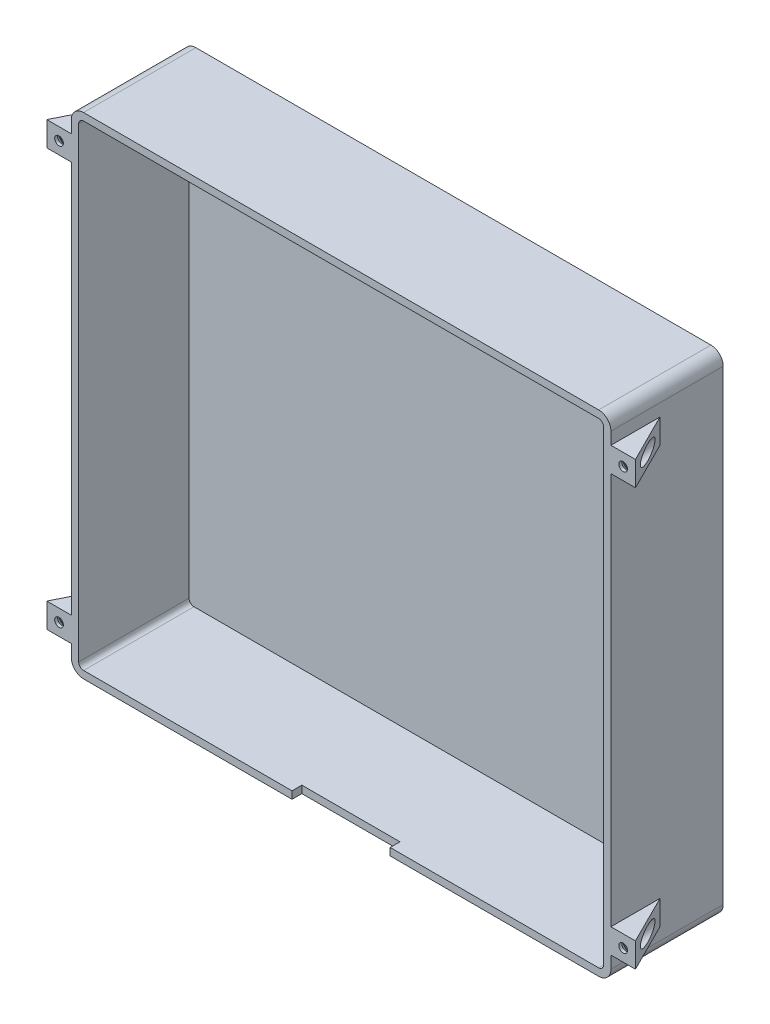
from build123d import *

# Parameters (mm, degrees)
SKETCH2_W               = 279.4
SKETCH2_H               = 254
BOSS_EXTRUDE1_DEPTH     = 1
FILLET2_R               = 6.35
BOSS_EXTRUDE3_START     = 57.15
BOSS_EXTRUDE3_DEPTH     = 57.15
SKETCH7_W               = 50.8
SKETCH7_H               = 5.08
CUT_EXTRUDE1_DEPTH      = 57.15
BOSS_EXTRUDE4_DEPTH     = 12.7
SKETCH9_R               = 3.81
CUT_EXTRUDE2_DEPTH      = 35.306
MIRROR3_COPY_1_DEPTH    = 12.7
MIRROR3_COPY_2_SKETCH_R = 3.81
MIRROR3_COPY_2_DEPTH    = 35.306
MIRROR4_COPY_1_DEPTH    = 12.7
MIRROR4_COPY_2_SKETCH_R = 3.81
MIRROR4_COPY_2_DEPTH    = 35.306
MIRROR4_COPY_4_DEPTH    = 12.7
MIRROR4_COPY_5_SKETCH_R = 3.81
MIRROR4_COPY_5_DEPTH    = 35.306
MIRROR4_COPY_7_DEPTH    = 12.7
MIRROR4_COPY_8_SKETCH_R = 3.81
MIRROR4_COPY_8_DEPTH    = 35.306
SKETCH15_W              = 12.7
SKETCH15_H              = 228.6
CUT_EXTRUDE4_DEPTH      = 30.226


with BuildPart() as part:
    # Sketch2 → Boss-Extrude1 (new body)
    with BuildSketch(Plane.XY):
        Rectangle(SKETCH2_W, SKETCH2_H)
    extrude(amount=BOSS_EXTRUDE1_DEPTH)

    # Fillet2
    fillet2_edges = [part.edges().sort_by_distance(p)[0] for p in [
        (139.7, -127, 0.5),
        (-139.7, -127, 0.5),
        (-139.7, 127, 0.5),
        (139.7, 127, 0.5),
    ]]
    fillet(fillet2_edges, radius=FILLET2_R)

    # Sketch5 → Boss-Extrude3 (add)
    with BuildSketch(Plane.XY.offset(1).offset(BOSS_EXTRUDE3_START)):
        with BuildLine():
            Line((-133.35, -127), (133.35, -127))
            ThreePointArc((133.35, -127), (137.840128061, -125.140128061), (139.7, -120.65))
            Line((139.7, -120.65), (139.7, 120.65))
            ThreePointArc((139.7, 120.65), (137.840128061, 125.140128061), (133.35, 127))
            Line((133.35, 127), (-133.35, 127))
            ThreePointArc((-133.35, 127), (-137.840128061, 125.140128061), (-139.7, 120.65))
            Line((-139.7, 120.65), (-139.7, -120.65))
            ThreePointArc((-139.7, -120.65), (-137.840128061, -125.140128061), (-133.35, -127))
        make_face()
        with BuildLine():
            Line((-133.35, -123.19), (133.35, -123.19))
            ThreePointArc((133.35, -123.19), (135.146051224, -122.446051224), (135.89, -120.65))
            Line((135.89, -120.65), (135.89, 120.65))
            ThreePointArc((135.89, 120.65), (135.146051224, 122.446051224), (133.35, 123.19))
            Line((133.35, 123.19), (-133.35, 123.19))
            ThreePointArc((-133.35, 123.19), (-135.146051224, 122.446051224), (-135.89, 120.65))
            Line((-135.89, 120.65), (-135.89, -120.65))
            ThreePointArc((-135.89, -120.65), (-135.146051224, -122.446051224), (-133.35, -123.19))
        make_face(mode=Mode.SUBTRACT)
    extrude(amount=-BOSS_EXTRUDE3_DEPTH)

    # Sketch7 → Cut-Extrude1 (cut)
    with BuildSketch(Plane(origin=(0, -123.19, 0), x_dir=(1, 0, 0), z_dir=(0, 1, 0))):
        with Locations((0, -55.61)):
            Rectangle(SKETCH7_W, SKETCH7_H)
    extrude(amount=-CUT_EXTRUDE1_DEPTH, mode=Mode.SUBTRACT)

    # Sketch8 → Boss-Extrude4 (add)
    with BuildSketch(Plane(origin=(0, 101.6, 0), x_dir=(1, 0, 0), z_dir=(0, 1, 0))):
        Polygon((-139.7, 0), (-152.4, 0), (-139.7, -25.4), align=None)
    boss_extrude4 = extrude(amount=BOSS_EXTRUDE4_DEPTH)

    # Sketch9 → Cut-Extrude2 (cut)
    with BuildSketch(Plane(origin=(0, 0, 3.81), x_dir=(-1, 0, 0), z_dir=(0, 0, -1))):
        with Locations((146.05, 107.95)):
            Circle(SKETCH9_R)
    cut_extrude2 = extrude(amount=-CUT_EXTRUDE2_DEPTH, mode=Mode.SUBTRACT)

    # Sketch13 → CSK for #8 Flat Head Machine Screw1 (revolve, cut)
    with BuildSketch(Plane(origin=(-146.05, 107.95, 3.81), x_dir=(0, -1, 0), z_dir=(1, 0, 0))):
        Polygon((0, 0), (0, 3.81), (2.2479, 3.81), (2.2479, 2.26450021), (4.2164, 0), align=None)
    csk_for_8_flat_head_machine_screw1 = revolve(axis=Axis((-146.05, 107.95, 10.16), (0, 0, -1)), mode=Mode.SUBTRACT)

    # Mirror2: Boss-Extrude4, Cut-Extrude2, CSK for #8 Flat Head Machine Screw1 across plane
    add(boss_extrude4.mirror(Plane.ZX))
    add(cut_extrude2.mirror(Plane.ZX), mode=Mode.SUBTRACT)
    add(csk_for_8_flat_head_machine_screw1.mirror(Plane.ZX), mode=Mode.SUBTRACT)

    # Mirror3: Boss-Extrude4, Cut-Extrude2, CSK for #8 Flat Head Machine Screw1 across plane
    add(boss_extrude4.mirror(Plane.ZY))
    add(cut_extrude2.mirror(Plane.ZY), mode=Mode.SUBTRACT)
    add(csk_for_8_flat_head_machine_screw1.mirror(Plane.ZY), mode=Mode.SUBTRACT)

    # Mirror3 copy 1 sketch → Mirror3 copy 1 (add)
    with BuildSketch(Plane(origin=(0, -101.6, 0), x_dir=(-1, 0, 0), z_dir=(0, -1, 0))):
        Polygon((-139.7, 0), (-152.4, 0), (-139.7, -25.4), align=None)
    extrude(amount=MIRROR3_COPY_1_DEPTH)

    # Mirror3 copy 2 sketch → Mirror3 copy 2 (cut)
    with BuildSketch(Plane(origin=(0, 0, 3.81), x_dir=(1, 0, 0), z_dir=(0, 0, -1))):
        with Locations((146.05, 107.95)):
            Circle(MIRROR3_COPY_2_SKETCH_R)
    extrude(amount=-MIRROR3_COPY_2_DEPTH, mode=Mode.SUBTRACT)

    # Mirror3 copy 3 sketch → Mirror3 copy 3 (revolve, cut)
    with BuildSketch(Plane(origin=(146.05, -107.95, 3.81), x_dir=(0, 1, 0), z_dir=(-1, 0, 0))):
        Polygon((0, 0), (0, 3.81), (2.2479, 3.81), (2.2479, 2.26450021), (4.2164, 0), align=None)
    revolve(axis=Axis((146.05, -107.95, 10.16), (0, 0, -1)), mode=Mode.SUBTRACT)

    # Mirror4: Boss-Extrude4, Cut-Extrude2, CSK for #8 Flat Head Machine Screw1 across plane
    add(boss_extrude4.mirror(Plane(origin=(0, 0, 29.075), x_dir=(1, 0, 0), z_dir=(0, 0, -1))))
    add(cut_extrude2.mirror(Plane(origin=(0, 0, 29.075), x_dir=(1, 0, 0), z_dir=(0, 0, -1))), mode=Mode.SUBTRACT)
    add(csk_for_8_flat_head_machine_screw1.mirror(Plane(origin=(0, 0, 29.075), x_dir=(1, 0, 0), z_dir=(0, 0, -1))), mode=Mode.SUBTRACT)

    # Mirror4 copy 1 sketch → Mirror4 copy 1 (add)
    with BuildSketch(Plane(origin=(0, -101.6, 58.15), x_dir=(1, 0, 0), z_dir=(0, -1, 0))):
        Polygon((-139.7, 0), (-152.4, 0), (-139.7, -25.4), align=None)
    extrude(amount=MIRROR4_COPY_1_DEPTH)

    # Mirror4 copy 2 sketch → Mirror4 copy 2 (cut)
    with BuildSketch(Plane(origin=(0, 0, 54.34), x_dir=(-1, 0, 0), z_dir=(0, 0, 1))):
        with Locations((146.05, 107.95)):
            Circle(MIRROR4_COPY_2_SKETCH_R)
    extrude(amount=-MIRROR4_COPY_2_DEPTH, mode=Mode.SUBTRACT)

    # Mirror4 copy 3 sketch → Mirror4 copy 3 (revolve, cut)
    with BuildSketch(Plane(origin=(-146.05, -107.95, 54.34), x_dir=(0, 1, 0), z_dir=(1, 0, 0))):
        Polygon((0, 0), (0, 3.81), (2.2479, 3.81), (2.2479, 2.26450021), (4.2164, 0), align=None)
    revolve(axis=Axis((-146.05, -107.95, 47.99), (0, 0, 1)), mode=Mode.SUBTRACT)

    # Mirror4 copy 4 sketch → Mirror4 copy 4 (add)
    with BuildSketch(Plane(origin=(0, 101.6, 58.15), x_dir=(-1, 0, 0), z_dir=(0, 1, 0))):
        Polygon((-139.7, 0), (-152.4, 0), (-139.7, -25.4), align=None)
    extrude(amount=MIRROR4_COPY_4_DEPTH)

    # Mirror4 copy 5 sketch → Mirror4 copy 5 (cut)
    with BuildSketch(Plane.XY.offset(54.34)):
        with Locations((146.05, 107.95)):
            Circle(MIRROR4_COPY_5_SKETCH_R)
    extrude(amount=-MIRROR4_COPY_5_DEPTH, mode=Mode.SUBTRACT)

    # Mirror4 copy 6 sketch → Mirror4 copy 6 (revolve, cut)
    with BuildSketch(Plane(origin=(146.05, 107.95, 54.34), x_dir=(0, -1, 0), z_dir=(-1, 0, 0))):
        Polygon((0, 0), (0, 3.81), (2.2479, 3.81), (2.2479, 2.26450021), (4.2164, 0), align=None)
    revolve(axis=Axis((146.05, 107.95, 47.99), (0, 0, 1)), mode=Mode.SUBTRACT)

    # Mirror4 copy 7 sketch → Mirror4 copy 7 (add)
    with BuildSketch(Plane(origin=(0, -101.6, 58.15), x_dir=(-1, 0, 0), z_dir=(0, -1, 0))):
        Polygon((-139.7, 0), (-152.4, 0), (-139.7, 25.4), align=None)
    extrude(amount=MIRROR4_COPY_7_DEPTH)

    # Mirror4 copy 8 sketch → Mirror4 copy 8 (cut)
    with BuildSketch(Plane.XY.offset(54.34)):
        with Locations((146.05, -107.95)):
            Circle(MIRROR4_COPY_8_SKETCH_R)
    extrude(amount=-MIRROR4_COPY_8_DEPTH, mode=Mode.SUBTRACT)

    # Mirror4 copy 9 sketch → Mirror4 copy 9 (revolve, cut)
    with BuildSketch(Plane(origin=(146.05, -107.95, 54.34), x_dir=(0, 1, 0), z_dir=(-1, 0, 0))):
        Polygon((0, 0), (0, -3.81), (2.2479, -3.81), (2.2479, -2.26450021), (4.2164, 0), align=None)
    revolve(axis=Axis((146.05, -107.95, 47.99), (0, 0, -1)), mode=Mode.SUBTRACT)

    # Sketch15 → Cut-Extrude4 (cut)
    with BuildSketch(Plane(origin=(0, 0, 0), x_dir=(-1, 0, 0), z_dir=(0, 0, -1))):
        with Locations((-146.05, 0)):
            Rectangle(SKETCH15_W, SKETCH15_H)
        with Locations((146.05, 0)):
            Rectangle(SKETCH15_W, SKETCH15_H)
    extrude(amount=-CUT_EXTRUDE4_DEPTH, mode=Mode.SUBTRACT)


solid = part.part
